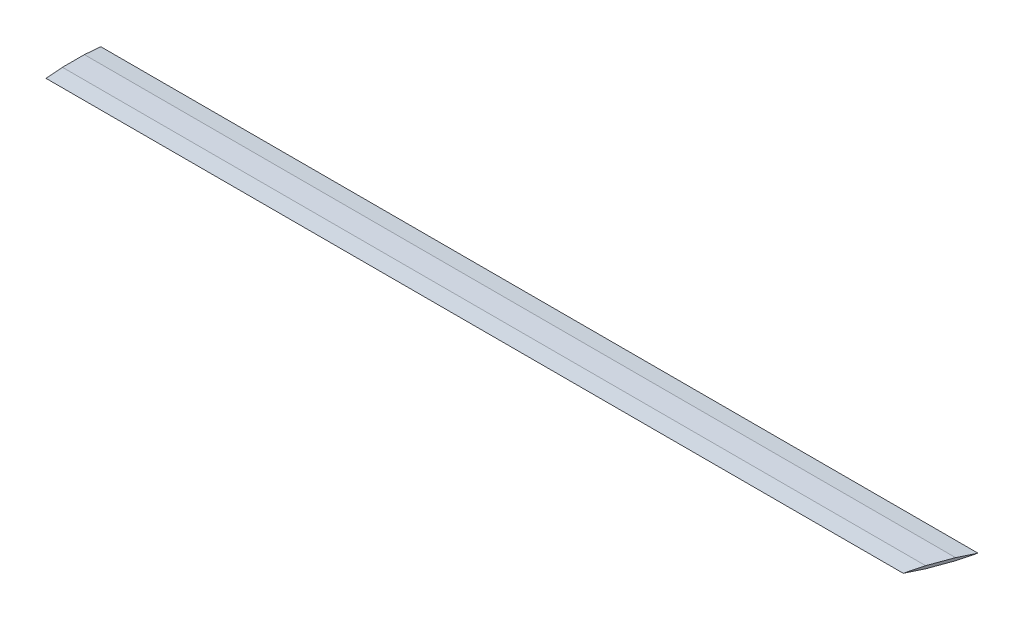
from build123d import *

# Parameters (mm, degrees)
BOSS_EXTRUDE1_DEPTH = 1
CHAMFER1_SIZE       = 0.5
CHAMFER1_SIZE_2     = 6
CHAMFER2_SIZE       = 6
CHAMFER2_SIZE_2     = 0.5


with BuildPart() as part:
    # Sketch1 → Boss-Extrude1 (new body)
    with BuildSketch(Plane(origin=(0, 0, 0), x_dir=(1, 0, 0), z_dir=(0, 1, 0))):
        Polygon((0, -20), (0, 0), (320, 0), (312.720595315, -20), align=None)
    extrude(amount=BOSS_EXTRUDE1_DEPTH)

    # Chamfer1
    # the kernel refuses this chamfer: 6, 0.5 mm, written as the material it takes off along each edge
    with BuildSketch(Plane(origin=(-15.598007041, 0, 0), x_dir=(0, 0.908488621033374, -0.4179095900465534), z_dir=(1, 0, 0))) as chamfer1_piece_1:
        Polygon((CHAMFER1_SIZE * 0.908488621033, CHAMFER1_SIZE * 0.417909590047), (-CHAMFER1_SIZE_2 * 0.417909590047, CHAMFER1_SIZE_2 * 0.908488621033), (0, 0), align=None)
    extrude(amount=351.196014082, mode=Mode.SUBTRACT)
    with BuildSketch(Plane(origin=(-15.598007041, 1, 0), x_dir=(0, -0.908488621033374, -0.4179095900465534), z_dir=(1, 0, 0))) as chamfer1_piece_2:
        Polygon((CHAMFER1_SIZE * 0.908488621033, -CHAMFER1_SIZE * 0.417909590047), (-CHAMFER1_SIZE_2 * 0.417909590047, -CHAMFER1_SIZE_2 * 0.908488621033), (0, 0), align=None)
    extrude(amount=351.196014082, mode=Mode.SUBTRACT)

    # Chamfer2
    # the kernel refuses this chamfer: 6, 0.5 mm, written as the material it takes off along each edge
    with BuildSketch(Plane(origin=(328.318602356, 0, 20), x_dir=(0, -0.0031944650224573633, -0.9999948976835933), z_dir=(-1, 0, 0))) as chamfer2_piece_1:
        Polygon((CHAMFER2_SIZE * 0.999994897684, -CHAMFER2_SIZE * 0.00319446502246), (-CHAMFER2_SIZE_2 * 0.00319446502246, -CHAMFER2_SIZE_2 * 0.999994897684), (0, 0), align=None)
    extrude(amount=343.916609397, mode=Mode.SUBTRACT)
    with BuildSketch(Plane(origin=(328.318602356, 1, 20), x_dir=(0, 0.0031944650224573715, -0.9999948976835933), z_dir=(-1, 0, 0))) as chamfer2_piece_2:
        Polygon((CHAMFER2_SIZE * 0.999994897684, CHAMFER2_SIZE * 0.00319446502246), (-CHAMFER2_SIZE_2 * 0.00319446502246, CHAMFER2_SIZE_2 * 0.999994897684), (0, 0), align=None)
    extrude(amount=343.916609397, mode=Mode.SUBTRACT)


solid = part.part
